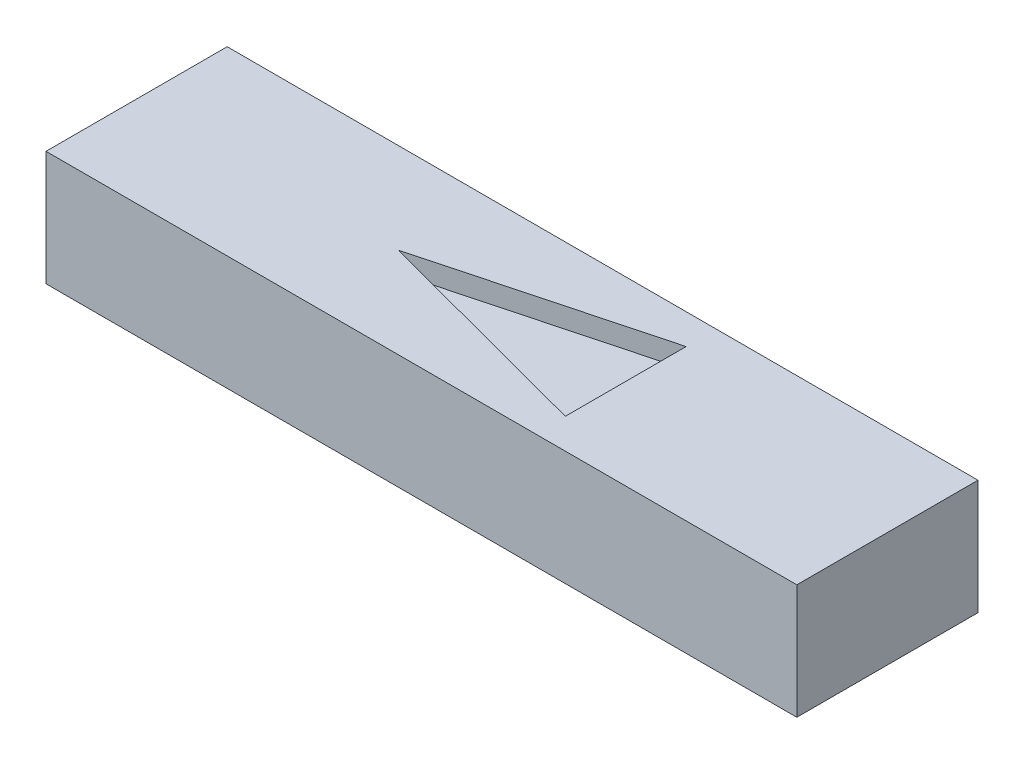
from build123d import *

# Parameters (mm, degrees)
SKETCH2_W           = 37.3
SKETCH2_H           = 9
BOSS_EXTRUDE1_DEPTH = 5.7
CUT_EXTRUDE1_DEPTH  = 1


with BuildPart() as part:
    # Sketch2 → Boss-Extrude1 (new body)
    with BuildSketch(Plane(origin=(0, 0, 0), x_dir=(1, 0, 0), z_dir=(0, 1, 0))):
        with Locations((18.65, 4.5)):
            Rectangle(SKETCH2_W, SKETCH2_H)
    extrude(amount=BOSS_EXTRUDE1_DEPTH)

    # Sketch3 → Cut-Extrude1 (cut)
    with BuildSketch(Plane(origin=(0, 5.7, 0), x_dir=(1, 0, 0), z_dir=(0, 1, 0))):
        Polygon((13, 4.5), (24.3, 1.5), (24.3, 7.5), align=None)
    extrude(amount=-CUT_EXTRUDE1_DEPTH, mode=Mode.SUBTRACT)


solid = part.part
